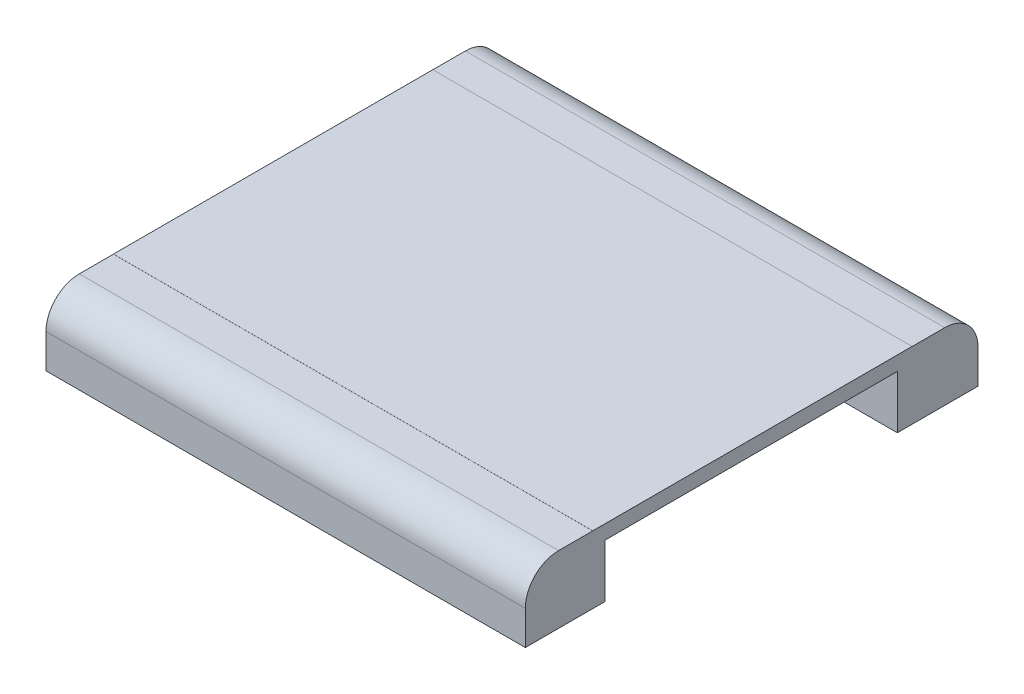
from build123d import *

# Parameters (mm, degrees)
SKETCH_3_W                      = 36
SKETCH_3_H                      = 10
EXTRUDE_1_DEPTH                 = 34
SHELL_1_T                       = -1
EXTRUDE_3_DEPTH                 = 18
EXTRUDE_3_DEPTH_BACK            = 18
SKETCH_4_W                      = 23.985162527
SKETCH_4_H                      = 5.996290528
FILLET_9_R                      = 2.5
EXTRUDE_6_DEPTH                 = 4
EXTRUDE_6_DEPTH_BACK            = 3.2
EXTRUDE_7_DEPTH                 = 4
EXTRUDE_7_DEPTH_BACK            = 3.2
FILLET_11_R                     = 2.5
EXTRUDE_START                   = -5
EXTRUDE_8_DEPTH                 = 9
CUT_EXTRUDE_START               = 17
SKETCH_8_W                      = 9.2
SKETCH_8_H                      = 1.40146724
CUT_EXTRUDE_3_DEPTH             = 0.5
CUT_EXTRUDE_4_REACH             = 40.795
SKETCH_11_W                     = 21.965454815
SKETCH_11_H                     = 3.993719057
CUT_EXTRUDE_4_DIRECTION_2_REACH = 40.795
SKETCH_10_W                     = 1.1
SKETCH_10_H                     = 7.7
SKETCH_10_W_2                   = 1.122304396
SKETCH_10_W_3                   = 1.111152198
SKETCH_10_W_4                   = 1.088342312
SKETCH_10_W_5                   = 1.094171156
CUT_EXTRUDE_5_DEPTH             = 0.991590454
SPLIT_START                     = -5
SPLIT_BODIES_2_OUTLINE_W        = 36
SPLIT_BODIES_2_OUTLINE_H        = 34
SPLIT_BODIES_2_OUTLINE_W_2      = 1.1
SPLIT_BODIES_2_OUTLINE_H_2      = 7.7
SPLIT_BODIES_2_OUTLINE_W_3      = 1.111152198
SPLIT_BODIES_2_OUTLINE_W_4      = 1.094171156
SPLIT_BODIES_2_OUTLINE_W_5      = 1.122304396
SPLIT_BODIES_2_OUTLINE_W_6      = 1.088342312
SPLIT_BODIES_2_DEPTH            = 4.942187478


# Read off the part's stored shape, not the designer's step: 分割1, 分割2
with BuildPart() as part:
    # 草图3 → 凸台-拉伸1 (new body)
    with BuildSketch(Plane.XY):
        Rectangle(SKETCH_3_W, SKETCH_3_H)
    extrude(amount=EXTRUDE_1_DEPTH)

    # 抽壳1
    shell_1_openings = [part.faces().sort_by_distance(p)[0] for p in [
        (0, -5, 17),
    ]]
    offset(amount=SHELL_1_T, openings=shell_1_openings, kind=Kind.INTERSECTION)

    # 草图4 → 凸台-拉伸3 (add, two sides: drawn at the far end of the back side and taken through both)
    with BuildSketch(Plane(origin=(0, 0, 0), x_dir=(0, 0, -1), z_dir=(1, 0, 0)).offset(-EXTRUDE_3_DEPTH_BACK)):
        with Locations((-16.943109173, 2.00655481)):
            Rectangle(SKETCH_4_W, SKETCH_4_H)
    extrude(amount=EXTRUDE_3_DEPTH + EXTRUDE_3_DEPTH_BACK)

    # 圆角9
    fillet_9_edges = [part.edges().sort_by_distance(p)[0] for p in [
        (0, 5, 34),
    ]]
    fillet(fillet_9_edges, radius=FILLET_9_R)

    # 草图6 → 凸台-拉伸6 (add, two sides: drawn at the far end of the back side and taken through both)
    with BuildSketch(Plane(origin=(0, 0, 0), x_dir=(1, 0, 0), z_dir=(0, 1, 0)).offset(-EXTRUDE_6_DEPTH_BACK)):
        Polygon((4.859681811, -32.9683063), (7.403408748, -30.245536487), (12.359177608, -30.245536487), (13.940012235, -30.245536487), (13.940012235, -32.9683063), align=None)
    extrude(amount=EXTRUDE_6_DEPTH + EXTRUDE_6_DEPTH_BACK)

    # 草图7 → 凸台-拉伸7 (add, two sides: drawn at the far end of the back side and taken through both)
    with BuildSketch(Plane(origin=(0, 0, 0), x_dir=(1, 0, 0), z_dir=(0, 1, 0)).offset(-EXTRUDE_7_DEPTH_BACK)):
        Polygon((2.54458171, -0.980815803), (-0.105019187, -3.27043557), (-3.683509766, -3.27043557), (-5.662056301, -0.980815803), align=None)
    extrude(amount=EXTRUDE_7_DEPTH + EXTRUDE_7_DEPTH_BACK)

    # 圆角11
    fillet_11_edges = [part.edges().sort_by_distance(p)[0] for p in [
        (0, 5, 0),
    ]]
    fillet(fillet_11_edges, radius=FILLET_11_R)

    # 草图5 → 凸台-拉伸8 (add)
    with BuildSketch(Plane(origin=(0, 0, 0), x_dir=(1, 0, 0), z_dir=(0, 1, 0)).offset(EXTRUDE_START)):
        Polygon((-3.212354085, -1), (-2.299075535, -1.958092867), (-1.257675535, -1.958092867), (-0.046128087, -1), align=None)
        Polygon((7.806276899, -33), (8.868785029, -31.937293749), (11.523785029, -31.937293749), (11.523785029, -33), align=None)
    extrude(amount=EXTRUDE_8_DEPTH)

    # 草图8 → 切除-拉伸3 (cut)
    with BuildSketch(Plane(origin=(0, 0, 0), x_dir=(0, 0, -1), z_dir=(1, 0, 0)).offset(CUT_EXTRUDE_START)):
        with Locations((-26.021321233, -4.299270344)):
            Rectangle(SKETCH_8_W, SKETCH_8_H)
    extrude(amount=CUT_EXTRUDE_3_DEPTH, mode=Mode.SUBTRACT)

    # 切除-拉伸4: up to this face of the body (flat: up to its plane)
    cut_extrude_4_end = Plane(part.part.faces().sort_by_distance((-18, -0.033638706, 16.999980993))[0])
    # 草图11 → 切除-拉伸4 (cut, up to the picked face)
    with BuildSketch(Plane(origin=(0, 0, 0), x_dir=(0, 0, -1), z_dir=(1, 0, 0)), mode=Mode.PRIVATE) as cut_extrude_4_sk1:
        with Locations((-17.041422709, 1.939047007)):
            Rectangle(SKETCH_11_W, SKETCH_11_H)
    cut_extrude_4_tool1 = split(extrude(cut_extrude_4_sk1.sketch, amount=-CUT_EXTRUDE_4_REACH, mode=Mode.PRIVATE), bisect_by=cut_extrude_4_end, keep=Keep.BOTH, mode=Mode.PRIVATE)
    add(cut_extrude_4_tool1.solids().sort_by(Axis((0, 1.939047, 17.041423), (-1, 0, 0)))[0], mode=Mode.SUBTRACT)

    # 切除-拉伸4 direction 2: up to this face of the body (flat: up to its plane)
    cut_extrude_4_direction_2_end = Plane(part.part.faces().sort_by_distance((18, -0.033638706, 16.999980993))[0])
    # 草图11 → 切除-拉伸4 direction 2 (cut, up to the picked face)
    with BuildSketch(Plane(origin=(0, 0, 0), x_dir=(0, 0, -1), z_dir=(1, 0, 0)), mode=Mode.PRIVATE) as cut_extrude_4_direction_2_sk1:
        with Locations((-17.041422709, 1.939047007)):
            Rectangle(SKETCH_11_W, SKETCH_11_H)
    cut_extrude_4_direction_2_tool1 = split(extrude(cut_extrude_4_direction_2_sk1.sketch, amount=CUT_EXTRUDE_4_DIRECTION_2_REACH, mode=Mode.PRIVATE), bisect_by=cut_extrude_4_direction_2_end, keep=Keep.BOTH, mode=Mode.PRIVATE)
    add(cut_extrude_4_direction_2_tool1.solids().sort_by(Axis((0, 1.939047, 17.041423), (1, 0, 0)))[0], mode=Mode.SUBTRACT)

    # 草图10 → 切除-拉伸5 (cut)
    with BuildSketch(Plane(origin=(0, 0, 0), x_dir=(1, 0, 0), z_dir=(0, 1, 0))):
        with Locations((-10.631432442, -10.52972417)):
            Rectangle(SKETCH_10_W, SKETCH_10_H)
        with Locations((-10.631432442, -20.605915071)):
            Rectangle(SKETCH_10_W, SKETCH_10_H)
        with Locations((10.829939073, -20.605915071)):
            Rectangle(SKETCH_10_W, SKETCH_10_H)
        with Locations((10.829939073, -10.52972417)):
            Rectangle(SKETCH_10_W, SKETCH_10_H)
        with Locations((-6.938026669, -10.52972417)):
            Rectangle(SKETCH_10_W_2, SKETCH_10_H)
        with Locations((-6.943602768, -20.605915071)):
            Rectangle(SKETCH_10_W_3, SKETCH_10_H)
        with Locations((7.321076066, -10.52972417)):
            Rectangle(SKETCH_10_W_4, SKETCH_10_H)
        with Locations((7.323990488, -20.605915071)):
            Rectangle(SKETCH_10_W_5, SKETCH_10_H)
    extrude(amount=-CUT_EXTRUDE_5_DEPTH, mode=Mode.SUBTRACT)


with BuildPart() as body_2:
    # Split Bodies 1: the piece on the far side of the plane
    add(part.part)
    split(bisect_by=Plane(origin=(0, -0.057812522, 0), x_dir=(1, 0, 0), z_dir=(0, 1, 0)), keep=Keep.BOTTOM)

    # Split Bodies 2 outline → Split Bodies 2 (cut)
    with BuildSketch(Plane(origin=(0, 0, 0), x_dir=(1, 0, 0), z_dir=(0, 1, 0)).offset(SPLIT_START)):
        with Locations((0, -17)):
            Rectangle(SPLIT_BODIES_2_OUTLINE_W, SPLIT_BODIES_2_OUTLINE_H)
        Polygon((-17, -28.935690436), (17, -28.935690436), (17, -33), (11.523785029, -33), (11.523785029, -32.9683063), (13.940012235, -32.9683063), (13.940012235, -30.245536487), (7.403408748, -30.245536487), (4.859681811, -32.9683063), (7.83796469, -32.9683063), (7.806276899, -33), (-17, -33), align=None, mode=Mode.SUBTRACT)
        Polygon((17, -4.950527909), (-17, -4.950527909), (-17, -1), (-5.645478515, -1), (-3.683509766, -3.27043557), (-0.105019187, -3.27043557), (2.522381315, -1), (17, -1), align=None, mode=Mode.SUBTRACT)
        with Locations((-10.631432442, -20.605915071)):
            Rectangle(SPLIT_BODIES_2_OUTLINE_W_2, SPLIT_BODIES_2_OUTLINE_H_2, mode=Mode.SUBTRACT)
        with Locations((-6.943602768, -20.605915071)):
            Rectangle(SPLIT_BODIES_2_OUTLINE_W_3, SPLIT_BODIES_2_OUTLINE_H_2, mode=Mode.SUBTRACT)
        with Locations((7.323990488, -20.605915071)):
            Rectangle(SPLIT_BODIES_2_OUTLINE_W_4, SPLIT_BODIES_2_OUTLINE_H_2, mode=Mode.SUBTRACT)
        with Locations((10.829939073, -20.605915071)):
            Rectangle(SPLIT_BODIES_2_OUTLINE_W_2, SPLIT_BODIES_2_OUTLINE_H_2, mode=Mode.SUBTRACT)
        with Locations((-10.631432442, -10.52972417)):
            Rectangle(SPLIT_BODIES_2_OUTLINE_W_2, SPLIT_BODIES_2_OUTLINE_H_2, mode=Mode.SUBTRACT)
        with Locations((-6.938026669, -10.52972417)):
            Rectangle(SPLIT_BODIES_2_OUTLINE_W_5, SPLIT_BODIES_2_OUTLINE_H_2, mode=Mode.SUBTRACT)
        with Locations((7.321076066, -10.52972417)):
            Rectangle(SPLIT_BODIES_2_OUTLINE_W_6, SPLIT_BODIES_2_OUTLINE_H_2, mode=Mode.SUBTRACT)
        with Locations((10.829939073, -10.52972417)):
            Rectangle(SPLIT_BODIES_2_OUTLINE_W_2, SPLIT_BODIES_2_OUTLINE_H_2, mode=Mode.SUBTRACT)
    extrude(amount=SPLIT_BODIES_2_DEPTH, mode=Mode.SUBTRACT)


with BuildPart() as part_1:
    add(part.part)

    # Split Bodies 1
    split(bisect_by=Plane(origin=(0, -0.057812522, 0), x_dir=(1, 0, 0), z_dir=(0, 1, 0)), keep=Keep.TOP)


solid = part_1.part
